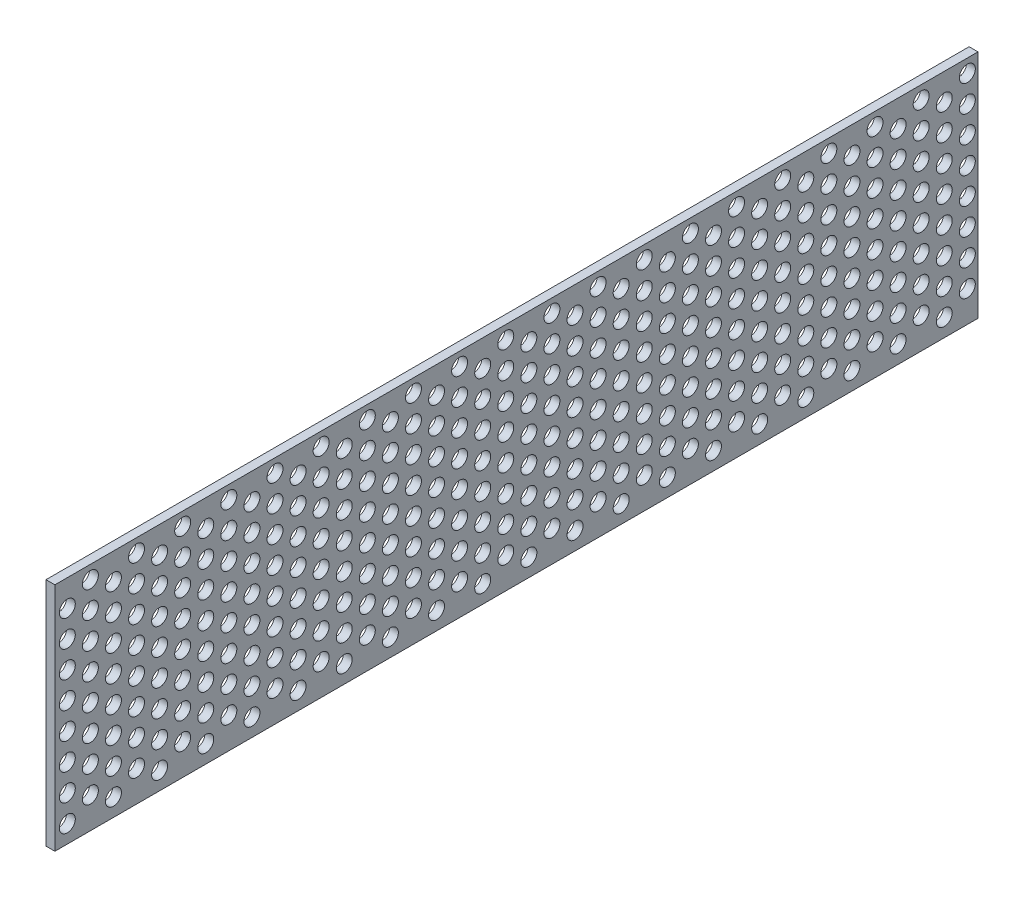
from build123d import *

# Parameters (mm, degrees)
SKETCH1_W            = 52
SKETCH1_H            = 13
BOSS_EXTRUDE1_DEPTH  = 0.5
CUT_EXTRUDE1_REACH   = 55.603
SKETCH2_R            = 0.45
LPATTERN1_COUNT      = 20
LPATTERN1_PITCH      = 2.6
LPATTERN1_COUNT_DIR2 = 4
LPATTERN1_PITCH_DIR2 = 3


with BuildPart() as part:
    # Sketch1 → Boss-Extrude1 (new body)
    with BuildSketch(Plane(origin=(0, 0, 0), x_dir=(0, 0, -1), z_dir=(1, 0, 0))):
        with Locations((26, 6.5)):
            Rectangle(SKETCH1_W, SKETCH1_H)
    extrude(amount=BOSS_EXTRUDE1_DEPTH)

    # Sketch2 → Cut-Extrude1 (cut, up to next)
    with BuildSketch(Plane(origin=(0.5, 0, 0), x_dir=(0, 0, -1), z_dir=(1, 0, 0)), mode=Mode.PRIVATE) as cut_extrude1_sk1:
        with Locations((0.7, 1)):
            Circle(SKETCH2_R)
    cut_extrude1_tool1 = extrude(cut_extrude1_sk1.sketch, amount=-CUT_EXTRUDE1_REACH, mode=Mode.PRIVATE) & part.part
    # Sketch2 → Cut-Extrude1 (cut, up to next)
    with BuildSketch(Plane(origin=(0.5, 0, 0), x_dir=(0, 0, -1), z_dir=(1, 0, 0)), mode=Mode.PRIVATE) as cut_extrude1_sk2:
        with Locations((0.7, 2.5)):
            Circle(SKETCH2_R)
    cut_extrude1_tool2 = extrude(cut_extrude1_sk2.sketch, amount=-CUT_EXTRUDE1_REACH, mode=Mode.PRIVATE) & part.part
    # Sketch2 → Cut-Extrude1 (cut, up to next)
    with BuildSketch(Plane(origin=(0.5, 0, 0), x_dir=(0, 0, -1), z_dir=(1, 0, 0)), mode=Mode.PRIVATE) as cut_extrude1_sk3:
        with Locations((1.999038106, 1.75)):
            Circle(SKETCH2_R)
    cut_extrude1_tool3 = extrude(cut_extrude1_sk3.sketch, amount=-CUT_EXTRUDE1_REACH, mode=Mode.PRIVATE) & part.part
    # Sketch2 → Cut-Extrude1 (cut, up to next)
    with BuildSketch(Plane(origin=(0.5, 0, 0), x_dir=(0, 0, -1), z_dir=(1, 0, 0)), mode=Mode.PRIVATE) as cut_extrude1_sk4:
        with Locations((1.999038106, 3.25)):
            Circle(SKETCH2_R)
    cut_extrude1_tool4 = extrude(cut_extrude1_sk4.sketch, amount=-CUT_EXTRUDE1_REACH, mode=Mode.PRIVATE) & part.part
    cut_extrude1_1 = cut_extrude1_tool1.solids().sort_by_distance((0.5, 1, -0.7))[0]
    add(cut_extrude1_1, mode=Mode.SUBTRACT)
    cut_extrude1_2 = cut_extrude1_tool2.solids().sort_by_distance((0.5, 2.5, -0.7))[0]
    add(cut_extrude1_2, mode=Mode.SUBTRACT)
    cut_extrude1_3 = cut_extrude1_tool3.solids().sort_by_distance((0.5, 1.75, -1.999038))[0]
    add(cut_extrude1_3, mode=Mode.SUBTRACT)
    cut_extrude1_4 = cut_extrude1_tool4.solids().sort_by_distance((0.5, 3.25, -1.999038))[0]
    add(cut_extrude1_4, mode=Mode.SUBTRACT)
    cut_extrude1 = cut_extrude1_1 + cut_extrude1_2 + cut_extrude1_3 + cut_extrude1_4  # Cut-Extrude1 as one shape, for the pattern or mirror that repeats it

    # LPattern1: Cut-Extrude1 20 × 4
    with Locations(*[(0, j * LPATTERN1_PITCH_DIR2, -i * LPATTERN1_PITCH) for i in range(LPATTERN1_COUNT) for j in range(LPATTERN1_COUNT_DIR2) if (i, j) != (0, 0)]):
        add(cut_extrude1, mode=Mode.SUBTRACT)


solid = part.part
